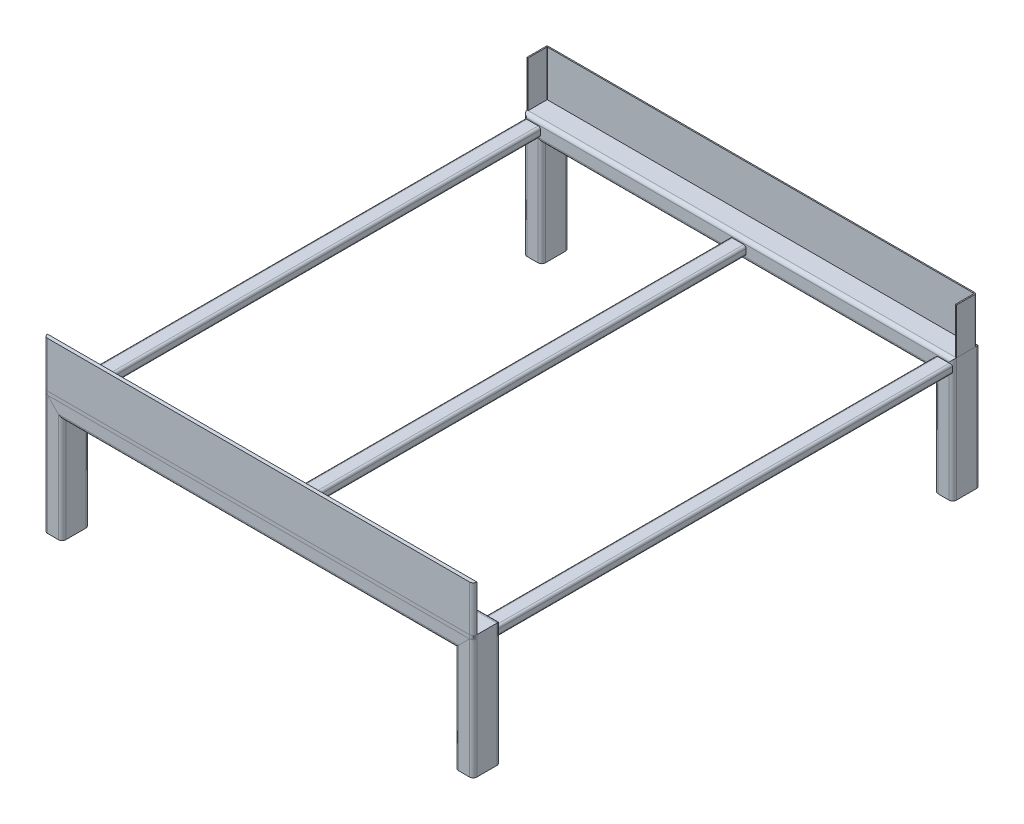
from build123d import *

# Parameters (mm, degrees)
F_70_X_40_X_5_13_DEPTH        = 2100
F_70_X_40_X_5_13_2_DEPTH      = 2100
F_70_X_40_X_5_13_3_DEPTH      = 2100
F_120_X_80_X_8_3_DEPTH        = 573.111025509
F_120_X_80_X_8_3_2_DEPTH      = 1946.222051019
F_120_X_80_X_8_3_3_DEPTH      = 500
F_120_X_80_X_8_3_3_DEPTH_BACK = 73.111025509
F_120_X_80_X_8_8_DEPTH        = 573.111025509
F_120_X_80_X_8_8_2_DEPTH      = 1946.222051019
F_120_X_80_X_8_8_3_DEPTH      = 500
F_120_X_80_X_8_8_3_DEPTH_BACK = 73.111025509
SM_BASE_FLANGE_2_DEPTH        = 200
SM_START                      = -16
SM_BASE_FLANGE_4_DEPTH        = 16
SM_BASE_FLANGE_5_DEPTH        = 200


# Read off the part's stored shape, not the designer's step: Базовая кромка4, Базовая кромка5
# Sheet-metal steps are written as plain solids
with BuildPart() as part:
    # Sketch111 → Прямоугольная труба 70 X 40 X 5(13) (new body)
    with BuildSketch(Plane(origin=(1800, 500, 0), x_dir=(0, 1, 0), z_dir=(0, 0, 1))):
        with BuildLine():
            Line((-10, -35), (10, -35))
            ThreePointArc((10, -35), (17.071067812, -32.071067812), (20, -25))
            Line((20, -25), (20, 25))
            ThreePointArc((20, 25), (17.071067812, 32.071067812), (10, 35))
            Line((10, 35), (-10, 35))
            ThreePointArc((-10, 35), (-17.071067812, 32.071067812), (-20, 25))
            Line((-20, 25), (-20, -25))
            ThreePointArc((-20, -25), (-17.071067812, -32.071067812), (-10, -35))
        make_face()
        with BuildLine():
            Line((-10, -30), (10, -30))
            ThreePointArc((10, -30), (13.535533906, -28.535533906), (15, -25))
            Line((15, -25), (15, 25))
            ThreePointArc((15, 25), (13.535533906, 28.535533906), (10, 30))
            Line((10, 30), (-10, 30))
            ThreePointArc((-10, 30), (-13.535533906, 28.535533906), (-15, 25))
            Line((-15, 25), (-15, -25))
            ThreePointArc((-15, -25), (-13.535533906, -28.535533906), (-10, -30))
        make_face(mode=Mode.SUBTRACT)
    extrude(amount=F_70_X_40_X_5_13_DEPTH)


with BuildPart() as body_2:
    # Sketch111 on segment 2 (carried to segment 2) → 70 X 40 X 5_13 2 (new body)
    with BuildSketch(Plane(origin=(900, 500, 0), x_dir=(0, 1, 0), z_dir=(0, 0, 1))):
        with BuildLine():
            Line((-10, -35), (10, -35))
            ThreePointArc((10, -35), (17.071067812, -32.071067812), (20, -25))
            Line((20, -25), (20, 25))
            ThreePointArc((20, 25), (17.071067812, 32.071067812), (10, 35))
            Line((10, 35), (-10, 35))
            ThreePointArc((-10, 35), (-17.071067812, 32.071067812), (-20, 25))
            Line((-20, 25), (-20, -25))
            ThreePointArc((-20, -25), (-17.071067812, -32.071067812), (-10, -35))
        make_face()
        with BuildLine():
            Line((-10, -30), (10, -30))
            ThreePointArc((10, -30), (13.535533906, -28.535533906), (15, -25))
            Line((15, -25), (15, 25))
            ThreePointArc((15, 25), (13.535533906, 28.535533906), (10, 30))
            Line((10, 30), (-10, 30))
            ThreePointArc((-10, 30), (-13.535533906, 28.535533906), (-15, 25))
            Line((-15, 25), (-15, -25))
            ThreePointArc((-15, -25), (-13.535533906, -28.535533906), (-10, -30))
        make_face(mode=Mode.SUBTRACT)
    extrude(amount=F_70_X_40_X_5_13_2_DEPTH)


with BuildPart() as body_3:
    # Sketch111 on segment 3 (carried to segment 3) → 70 X 40 X 5_13 3 (new body)
    with BuildSketch(Plane(origin=(0, 500, 0), x_dir=(0, 1, 0), z_dir=(0, 0, 1))):
        with BuildLine():
            Line((-10, -35), (10, -35))
            ThreePointArc((10, -35), (17.071067812, -32.071067812), (20, -25))
            Line((20, -25), (20, 25))
            ThreePointArc((20, 25), (17.071067812, 32.071067812), (10, 35))
            Line((10, 35), (-10, 35))
            ThreePointArc((-10, 35), (-17.071067812, 32.071067812), (-20, 25))
            Line((-20, 25), (-20, -25))
            ThreePointArc((-20, -25), (-17.071067812, -32.071067812), (-10, -35))
        make_face()
        with BuildLine():
            Line((-10, -30), (10, -30))
            ThreePointArc((10, -30), (13.535533906, -28.535533906), (15, -25))
            Line((15, -25), (15, 25))
            ThreePointArc((15, 25), (13.535533906, 28.535533906), (10, 30))
            Line((10, 30), (-10, 30))
            ThreePointArc((-10, 30), (-13.535533906, 28.535533906), (-15, 25))
            Line((-15, 25), (-15, -25))
            ThreePointArc((-15, -25), (-13.535533906, -28.535533906), (-10, -30))
        make_face(mode=Mode.SUBTRACT)
    extrude(amount=F_70_X_40_X_5_13_3_DEPTH)


with BuildPart() as body_4:
    # Sketch1 on segment 1 (carried to segment 1) → Прямоугольная труба 120 X 80 X 8(3) (new body)
    with BuildSketch(Plane(origin=(0, 0, 0), x_dir=(-1, 0, 0), z_dir=(0, 1, 0))):
        with BuildLine():
            Line((-24, -60), (24, -60))
            ThreePointArc((24, -60), (35.313708499, -55.313708499), (40, -44))
            Line((40, -44), (40, 44))
            ThreePointArc((40, 44), (35.313708499, 55.313708499), (24, 60))
            Line((24, 60), (-24, 60))
            ThreePointArc((-24, 60), (-35.313708499, 55.313708499), (-40, 44))
            Line((-40, 44), (-40, -44))
            ThreePointArc((-40, -44), (-35.313708499, -55.313708499), (-24, -60))
        make_face()
        with BuildLine():
            Line((-24, -52), (24, -52))
            ThreePointArc((24, -52), (29.656854249, -49.656854249), (32, -44))
            Line((32, -44), (32, 44))
            ThreePointArc((32, 44), (29.656854249, 49.656854249), (24, 52))
            Line((24, 52), (-24, 52))
            ThreePointArc((-24, 52), (-29.656854249, 49.656854249), (-32, 44))
            Line((-32, 44), (-32, -44))
            ThreePointArc((-32, -44), (-29.656854249, -49.656854249), (-24, -52))
        make_face(mode=Mode.SUBTRACT)
    extrude(amount=F_120_X_80_X_8_3_DEPTH)

    # Прямоугольная труба 120 X 80 X 8(3) mitre 1
    split(bisect_by=Plane(origin=(0, 500, 0), x_dir=(0.707106781, -0.707106781, 0), z_dir=(-0.707106781, -0.707106781, 0)), keep=Keep.TOP)


with BuildPart() as body_5:
    # Sketch1 on segment 2 (carried to segment 2) → 120 X 80 X 8_3 2 (new body)
    with BuildSketch(Plane(origin=(-73.111025509, 500, 0), x_dir=(0, 1, 0), z_dir=(1, 0, 0))):
        with BuildLine():
            Line((-24, -60), (24, -60))
            ThreePointArc((24, -60), (35.313708499, -55.313708499), (40, -44))
            Line((40, -44), (40, 44))
            ThreePointArc((40, 44), (35.313708499, 55.313708499), (24, 60))
            Line((24, 60), (-24, 60))
            ThreePointArc((-24, 60), (-35.313708499, 55.313708499), (-40, 44))
            Line((-40, 44), (-40, -44))
            ThreePointArc((-40, -44), (-35.313708499, -55.313708499), (-24, -60))
        make_face()
        with BuildLine():
            Line((-24, -52), (24, -52))
            ThreePointArc((24, -52), (29.656854249, -49.656854249), (32, -44))
            Line((32, -44), (32, 44))
            ThreePointArc((32, 44), (29.656854249, 49.656854249), (24, 52))
            Line((24, 52), (-24, 52))
            ThreePointArc((-24, 52), (-29.656854249, 49.656854249), (-32, 44))
            Line((-32, 44), (-32, -44))
            ThreePointArc((-32, -44), (-29.656854249, -49.656854249), (-24, -52))
        make_face(mode=Mode.SUBTRACT)
    extrude(amount=F_120_X_80_X_8_3_2_DEPTH)

    # 120 X 80 X 8_3 2 mitre 1
    split(bisect_by=Plane(origin=(0, 500, 0), x_dir=(-0.707106781, 0.707106781, 0), z_dir=(0.707106781, 0.707106781, 0)), keep=Keep.TOP)

    # 120 X 80 X 8_3 2 mitre 2
    split(bisect_by=Plane(origin=(1800, 500, 0), x_dir=(-0.707106781, -0.707106781, 0), z_dir=(-0.707106781, 0.707106781, 0)), keep=Keep.TOP)


with BuildPart() as body_6:
    # Sketch1 → 120 X 80 X 8_3 3 (new, two sides: drawn at the far end of the back side and taken through both)
    with BuildSketch(Plane(origin=(1800, 500, 0), x_dir=(1, 0, 0), z_dir=(0, -1, 0)).offset(-F_120_X_80_X_8_3_3_DEPTH_BACK)):
        with BuildLine():
            Line((-24, -60), (24, -60))
            ThreePointArc((24, -60), (35.313708499, -55.313708499), (40, -44))
            Line((40, -44), (40, 44))
            ThreePointArc((40, 44), (35.313708499, 55.313708499), (24, 60))
            Line((24, 60), (-24, 60))
            ThreePointArc((-24, 60), (-35.313708499, 55.313708499), (-40, 44))
            Line((-40, 44), (-40, -44))
            ThreePointArc((-40, -44), (-35.313708499, -55.313708499), (-24, -60))
        make_face()
        with BuildLine():
            Line((-24, -52), (24, -52))
            ThreePointArc((24, -52), (29.656854249, -49.656854249), (32, -44))
            Line((32, -44), (32, 44))
            ThreePointArc((32, 44), (29.656854249, 49.656854249), (24, 52))
            Line((24, 52), (-24, 52))
            ThreePointArc((-24, 52), (-29.656854249, 49.656854249), (-32, 44))
            Line((-32, 44), (-32, -44))
            ThreePointArc((-32, -44), (-29.656854249, -49.656854249), (-24, -52))
        make_face(mode=Mode.SUBTRACT)
    extrude(amount=F_120_X_80_X_8_3_3_DEPTH + F_120_X_80_X_8_3_3_DEPTH_BACK)

    # 120 X 80 X 8_3 3 mitre 1
    split(bisect_by=Plane(origin=(1800, 500, 0), x_dir=(0.707106781, 0.707106781, 0), z_dir=(0.707106781, -0.707106781, 0)), keep=Keep.TOP)


with BuildPart() as body_7:
    # Sketch115 on segment 1 (carried to segment 1) → Прямоугольная труба 120 X 80 X 8(8) (new body)
    with BuildSketch(Plane(origin=(0, 0, 2100), x_dir=(-1, 0, 0), z_dir=(0, 1, 0))):
        with BuildLine():
            Line((-24, -60), (24, -60))
            ThreePointArc((24, -60), (35.313708499, -55.313708499), (40, -44))
            Line((40, -44), (40, 44))
            ThreePointArc((40, 44), (35.313708499, 55.313708499), (24, 60))
            Line((24, 60), (-24, 60))
            ThreePointArc((-24, 60), (-35.313708499, 55.313708499), (-40, 44))
            Line((-40, 44), (-40, -44))
            ThreePointArc((-40, -44), (-35.313708499, -55.313708499), (-24, -60))
        make_face()
        with BuildLine():
            Line((-24, -52), (24, -52))
            ThreePointArc((24, -52), (29.656854249, -49.656854249), (32, -44))
            Line((32, -44), (32, 44))
            ThreePointArc((32, 44), (29.656854249, 49.656854249), (24, 52))
            Line((24, 52), (-24, 52))
            ThreePointArc((-24, 52), (-29.656854249, 49.656854249), (-32, 44))
            Line((-32, 44), (-32, -44))
            ThreePointArc((-32, -44), (-29.656854249, -49.656854249), (-24, -52))
        make_face(mode=Mode.SUBTRACT)
    extrude(amount=F_120_X_80_X_8_8_DEPTH)

    # Прямоугольная труба 120 X 80 X 8(8) mitre 1
    split(bisect_by=Plane(origin=(0, 500, 2100), x_dir=(0.707106781, -0.707106781, 0), z_dir=(-0.707106781, -0.707106781, 0)), keep=Keep.TOP)


with BuildPart() as body_8:
    # Sketch115 on segment 2 (carried to segment 2) → 120 X 80 X 8_8 2 (new body)
    with BuildSketch(Plane(origin=(-73.111025509, 500, 2100), x_dir=(0, 1, 0), z_dir=(1, 0, 0))):
        with BuildLine():
            Line((-24, -60), (24, -60))
            ThreePointArc((24, -60), (35.313708499, -55.313708499), (40, -44))
            Line((40, -44), (40, 44))
            ThreePointArc((40, 44), (35.313708499, 55.313708499), (24, 60))
            Line((24, 60), (-24, 60))
            ThreePointArc((-24, 60), (-35.313708499, 55.313708499), (-40, 44))
            Line((-40, 44), (-40, -44))
            ThreePointArc((-40, -44), (-35.313708499, -55.313708499), (-24, -60))
        make_face()
        with BuildLine():
            Line((-24, -52), (24, -52))
            ThreePointArc((24, -52), (29.656854249, -49.656854249), (32, -44))
            Line((32, -44), (32, 44))
            ThreePointArc((32, 44), (29.656854249, 49.656854249), (24, 52))
            Line((24, 52), (-24, 52))
            ThreePointArc((-24, 52), (-29.656854249, 49.656854249), (-32, 44))
            Line((-32, 44), (-32, -44))
            ThreePointArc((-32, -44), (-29.656854249, -49.656854249), (-24, -52))
        make_face(mode=Mode.SUBTRACT)
    extrude(amount=F_120_X_80_X_8_8_2_DEPTH)

    # 120 X 80 X 8_8 2 mitre 1
    split(bisect_by=Plane(origin=(0, 500, 2100), x_dir=(-0.707106781, 0.707106781, 0), z_dir=(0.707106781, 0.707106781, 0)), keep=Keep.TOP)

    # 120 X 80 X 8_8 2 mitre 2
    split(bisect_by=Plane(origin=(1800, 500, 2100), x_dir=(-0.707106781, -0.707106781, 0), z_dir=(-0.707106781, 0.707106781, 0)), keep=Keep.TOP)


with BuildPart() as body_9:
    # Sketch115 → 120 X 80 X 8_8 3 (new, two sides: drawn at the far end of the back side and taken through both)
    with BuildSketch(Plane(origin=(1800, 500, 2100), x_dir=(1, 0, 0), z_dir=(0, -1, 0)).offset(-F_120_X_80_X_8_8_3_DEPTH_BACK)):
        with BuildLine():
            Line((-24, -60), (24, -60))
            ThreePointArc((24, -60), (35.313708499, -55.313708499), (40, -44))
            Line((40, -44), (40, 44))
            ThreePointArc((40, 44), (35.313708499, 55.313708499), (24, 60))
            Line((24, 60), (-24, 60))
            ThreePointArc((-24, 60), (-35.313708499, 55.313708499), (-40, 44))
            Line((-40, 44), (-40, -44))
            ThreePointArc((-40, -44), (-35.313708499, -55.313708499), (-24, -60))
        make_face()
        with BuildLine():
            Line((-24, -52), (24, -52))
            ThreePointArc((24, -52), (29.656854249, -49.656854249), (32, -44))
            Line((32, -44), (32, 44))
            ThreePointArc((32, 44), (29.656854249, 49.656854249), (24, 52))
            Line((24, 52), (-24, 52))
            ThreePointArc((-24, 52), (-29.656854249, 49.656854249), (-32, 44))
            Line((-32, 44), (-32, -44))
            ThreePointArc((-32, -44), (-29.656854249, -49.656854249), (-24, -52))
        make_face(mode=Mode.SUBTRACT)
    extrude(amount=F_120_X_80_X_8_8_3_DEPTH + F_120_X_80_X_8_8_3_DEPTH_BACK)

    # 120 X 80 X 8_8 3 mitre 1
    split(bisect_by=Plane(origin=(1800, 500, 2100), x_dir=(0.707106781, 0.707106781, 0), z_dir=(0.707106781, -0.707106781, 0)), keep=Keep.TOP)


with BuildPart() as body_10:
    # Эскиз37 → Базовая кромка2 (new body)
    with BuildSketch(Plane(origin=(0, 540, 0), x_dir=(1, 0, 0), z_dir=(0, 1, 0))):
        with BuildLine():
            Line((1840, -44), (1840, 38.2634))
            ThreePointArc((1840, 38.2634), (1838.319788761, 42.319788761), (1834.2634, 44))
            Line((1834.2634, 44), (-34.2634, 44))
            ThreePointArc((-34.2634, 44), (-38.319788761, 42.319788761), (-40, 38.2634))
            Line((-40, 38.2634), (-40, -44))
            Line((-40, -44), (-35, -44))
            Line((-35, -44), (-35, 38.2634))
            ThreePointArc((-35, 38.2634), (-34.784254855, 38.784254855), (-34.2634, 39))
            Line((-34.2634, 39), (1834.2634, 39))
            ThreePointArc((1834.2634, 39), (1834.784254855, 38.784254855), (1835, 38.2634))
            Line((1835, 38.2634), (1835, -44))
            Line((1835, -44), (1840, -44))
        make_face()
    extrude(amount=SM_BASE_FLANGE_2_DEPTH)


with BuildPart() as body_11:
    # Базовая кромка4 outline → Базовая кромка4 (new body)
    with BuildSketch(Plane(origin=(0, 540, 0), x_dir=(1, 0, 0), z_dir=(0, 1, 0)).offset(SM_START)):
        with BuildLine():
            Line((1840, -2144), (-40, -2144))
            ThreePointArc((-40, -2144), (-35.313708499, -2155.313708499), (-24, -2160))
            Line((-24, -2160), (1824, -2160))
            ThreePointArc((1824, -2160), (1835.313708499, -2155.313708499), (1840, -2144))
        make_face()
    extrude(amount=SM_BASE_FLANGE_4_DEPTH)


with BuildPart() as body_12:
    # Базовая кромка5 outline → Базовая кромка5 (new body)
    with BuildSketch(Plane(origin=(0, 540, 0), x_dir=(1, 0, 0), z_dir=(0, 1, 0))):
        with BuildLine():
            ThreePointArc((-40, -2144), (-35.313708499, -2155.313708499), (-24, -2160))
            Line((-24, -2160), (1824, -2160))
            ThreePointArc((1824, -2160), (1835.313708499, -2155.313708499), (1840, -2144))
            Line((1840, -2144), (-40, -2144))
        make_face()
    extrude(amount=SM_BASE_FLANGE_5_DEPTH)


solid = Compound([part.part, body_2.part, body_3.part, body_4.part, body_5.part, body_6.part, body_7.part, body_8.part, body_9.part, body_10.part, body_11.part, body_12.part])
